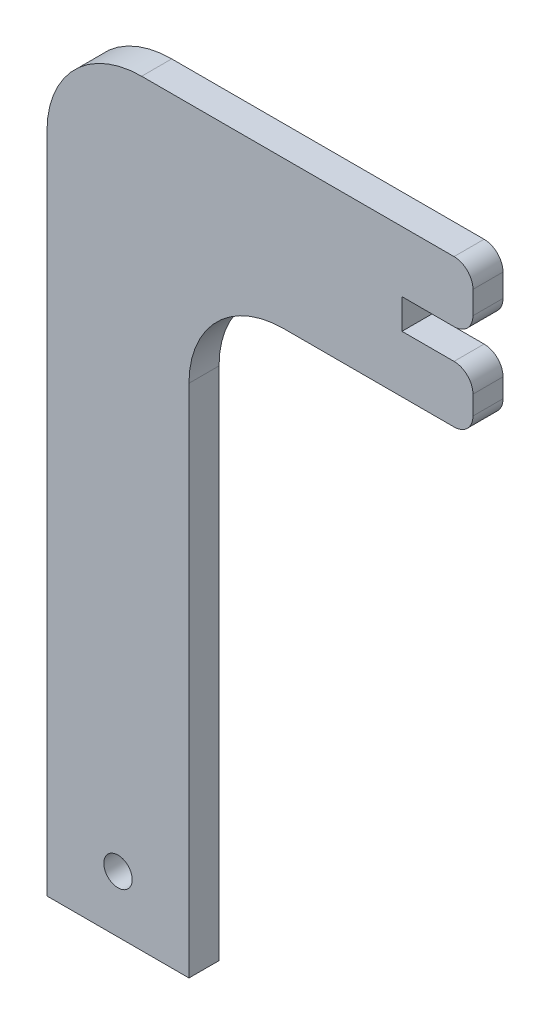
from build123d import *

# Parameters (mm, degrees)
SKETCH1_W           = 45
SKETCH1_H           = 80
BOSS_EXTRUDE1_DEPTH = 3.175
SKETCH2_W           = 15
SKETCH2_H           = 3.175
CUT_EXTRUDE1_DEPTH  = 92.842695001
SKETCH3_R           = 1.5
SKETCH3_W           = 30
SKETCH3_H           = 64.4125
CUT_EXTRUDE2_DEPTH  = 92.842695001
FILLET1_R           = 10
FILLET2_R           = 2


with BuildPart() as part:
    # Sketch1 → Boss-Extrude1 (new body)
    with BuildSketch(Plane.XY):
        with Locations((-22.5, -40)):
            Rectangle(SKETCH1_W, SKETCH1_H)
    extrude(amount=BOSS_EXTRUDE1_DEPTH)

    # Sketch2 → Cut-Extrude1 (cut, through all)
    with BuildSketch(Plane.XY.offset(3.175)):
        with Locations((0, -8)):
            Rectangle(SKETCH2_W, SKETCH2_H)
    extrude(amount=-CUT_EXTRUDE1_DEPTH, mode=Mode.SUBTRACT)

    # Sketch3 → Cut-Extrude2 (cut, through all)
    with BuildSketch(Plane.XY.offset(3.175)):
        with Locations((-37.5, -74)):
            Circle(SKETCH3_R)
        with Locations((-15, -47.79375)):
            Rectangle(SKETCH3_W, SKETCH3_H)
    extrude(amount=-CUT_EXTRUDE2_DEPTH, mode=Mode.SUBTRACT)

    # Fillet1
    fillet1_edges = [part.edges().sort_by_distance(p)[0] for p in [
        (-45, 0, 1.5875),
        (-30, -15.5875, 1.5875),
    ]]
    fillet(fillet1_edges, radius=FILLET1_R)

    # Fillet2
    fillet2_edges = [part.edges().sort_by_distance(p)[0] for p in [
        (0, -15.5875, 1.5875),
        (0, 0, 1.5875),
        (0, -9.5875, 1.5875),
        (0, -6.4125, 1.5875),
    ]]
    fillet(fillet2_edges, radius=FILLET2_R)


solid = part.part
